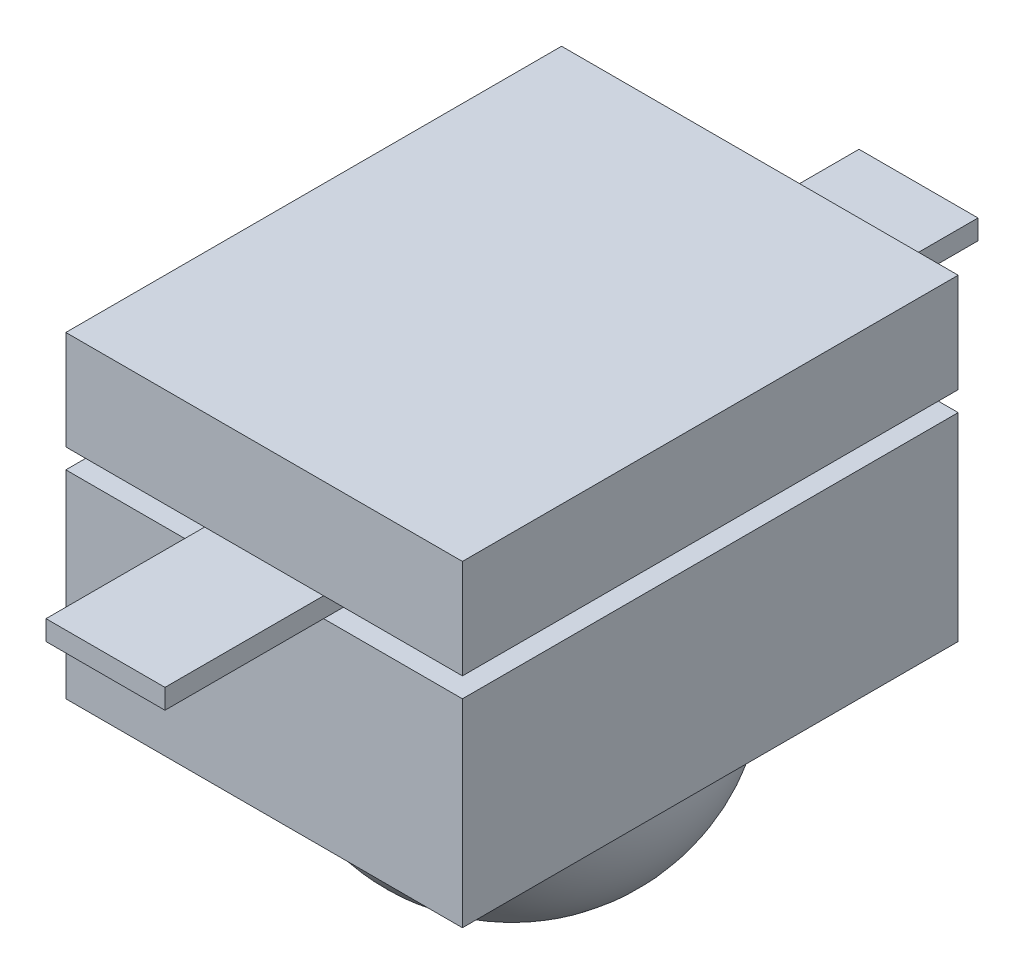
from build123d import *

# Parameters (mm, degrees)
SCHIZZO1_W                   = 2
SCHIZZO1_H                   = 2.5
ESTRUSIONE_ESTRUSIONE1_DEPTH = 1
SCHIZZO2_R                   = 0.9
ESTRUSIONE_ESTRUSIONE2_DEPTH = 0.9
RACCORDO1_R                  = 0.9
SCHIZZO4_W                   = 0.6
SCHIZZO4_H                   = 1
ESTRUSIONE_ESTRUSIONE3_DEPTH = 0.1
SCHIZZO6_W                   = 2
SCHIZZO6_H                   = 2.5
ESTRUSIONE_ESTRUSIONE5_DEPTH = 0.5


with BuildPart() as part:
    # Schizzo1 → Estrusione-Estrusione1 (new body)
    with BuildSketch(Plane(origin=(0, 0, 0), x_dir=(1, 0, 0), z_dir=(0, 1, 0))):
        with Locations((-9.560441298, -8.49809966)):
            Rectangle(SCHIZZO1_W, SCHIZZO1_H)
    extrude(amount=ESTRUSIONE_ESTRUSIONE1_DEPTH)

    # Schizzo2 → Estrusione-Estrusione2 (add)
    with BuildSketch(Plane.XZ):
        with Locations(Location((-9.560441298, 8.49809966, 0), (0, 0, 90))):
            Circle(SCHIZZO2_R)
    extrude(amount=ESTRUSIONE_ESTRUSIONE2_DEPTH)

    # Raccordo1
    raccordo1_edges = [part.edges().sort_by_distance(p)[0] for p in [
        (-9.560441298, -0.9, 7.59809966),
    ]]
    fillet(raccordo1_edges, radius=RACCORDO1_R - 0.0001)  # a hair under: the kernel refuses the full size

    # Schizzo4 → Estrusione-Estrusione3 (add)
    with BuildSketch(Plane(origin=(0, 1, 0), x_dir=(1, 0, 0), z_dir=(0, 1, 0))):
        Polygon((-10.360441298, -8.84809966), (-9.210441298, -8.84809966), (-9.210441298, -8.1199702), (-8.760441298, -8.1199702), (-8.760441298, -7.44809966), (-10.360441298, -7.44809966), align=None)
        Polygon((-10.360441298, -8.94809966), (-9.110441298, -8.94809966), (-9.110441298, -8.2199702), (-8.760441298, -8.2199702), (-8.760441298, -9.54809966), (-10.360441298, -9.54809966), align=None)
        with Locations((-9.560441298, -10.04809966)):
            Rectangle(SCHIZZO4_W, SCHIZZO4_H)
        with Locations((-9.560441298, -6.94809966)):
            Rectangle(SCHIZZO4_W, SCHIZZO4_H)
    extrude(amount=ESTRUSIONE_ESTRUSIONE3_DEPTH)

    # Schizzo6 → Estrusione-Estrusione5 (add)
    with BuildSketch(Plane(origin=(0, 1.1, 0), x_dir=(1, 0, 0), z_dir=(0, 1, 0))):
        with Locations((-9.560441298, -8.49809966)):
            Rectangle(SCHIZZO6_W, SCHIZZO6_H)
    extrude(amount=ESTRUSIONE_ESTRUSIONE5_DEPTH)


solid = part.part
